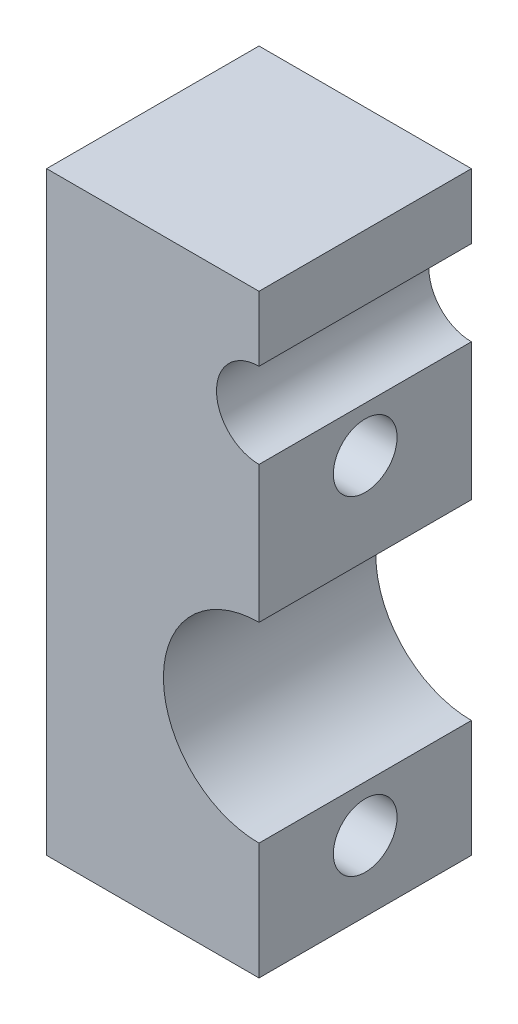
from build123d import *

# Parameters (mm, degrees)
SKETCH_1_W            = 10
SKETCH_1_H            = 10
EXTRUDE_1_DEPTH       = 28
SKETCH_2_R            = 4.499999995
CUT_EXTRUDE_2_DEPTH   = 31.149626863
SKETCH_3_R            = 1.5
CUT_EXTRUDE_1_DEPTH   = 31.149626863
SKETCH_4_R            = 1.999999993
CUT_EXTRUDE_2_2_DEPTH = 31.149626863


with BuildPart() as part:
    # Эскиз1 → Вытянуть1 (new body)
    with BuildSketch(Plane(origin=(0, 0, 0), x_dir=(1, 0, 0), z_dir=(0, 1, 0))):
        Rectangle(SKETCH_1_W, SKETCH_1_H)
    extrude(amount=EXTRUDE_1_DEPTH)

    # Эскиз2 → Cut-Extrude 2 (cut, through all)
    with BuildSketch(Plane.XY.offset(5)):
        with Locations((5.000000005, 10.000000001)):
            Circle(SKETCH_2_R)
    extrude(amount=-CUT_EXTRUDE_2_DEPTH, mode=Mode.SUBTRACT)

    # Эскиз3 → Вырез-Вытянуть1 (cut, through all)
    with BuildSketch(Plane(origin=(5, 0, 0), x_dir=(0, 0, -1), z_dir=(1, 0, 0))):
        with Locations((0, 3.309697202)):
            Circle(SKETCH_3_R)
        with Locations((0, 18.798896008)):
            Circle(SKETCH_3_R)
    extrude(amount=-CUT_EXTRUDE_1_DEPTH, mode=Mode.SUBTRACT)

    # Эскиз4 → Cut-Extrude 2 2 (cut, through all)
    with BuildSketch(Plane.XY.offset(5)):
        with Locations((4.999999972, 22.940656165)):
            Circle(SKETCH_4_R)
    extrude(amount=-CUT_EXTRUDE_2_2_DEPTH, mode=Mode.SUBTRACT)


solid = part.part
